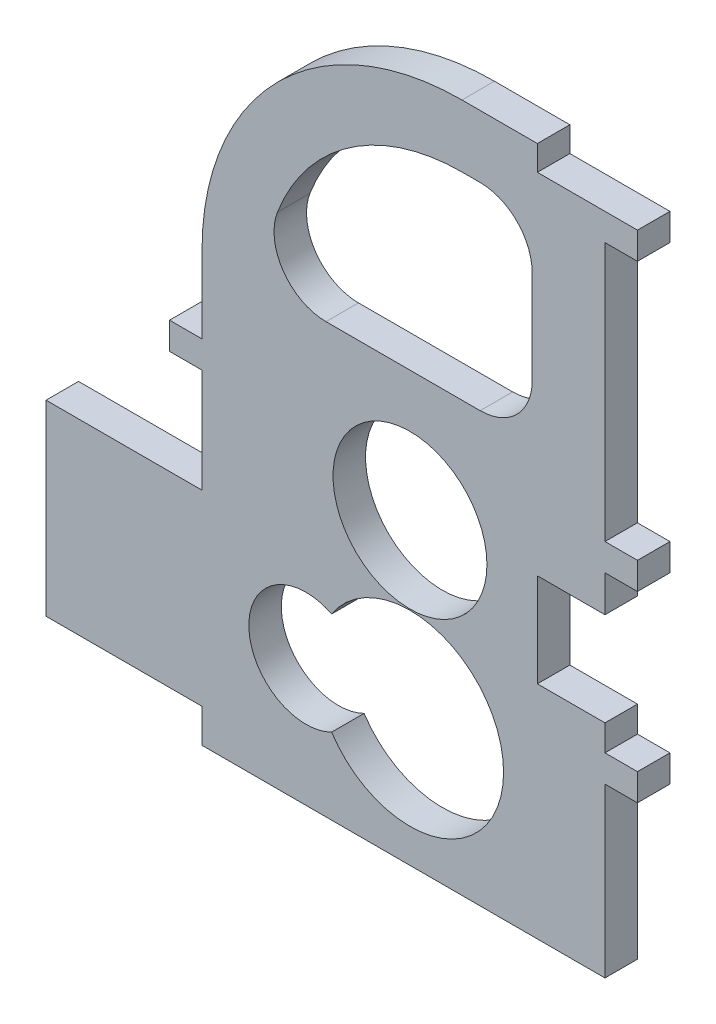
from build123d import *

# Parameters (mm, degrees)
SKETCH1_R           = 3.7592
BOSS_EXTRUDE1_DEPTH = 1.5875
CUT_EXTRUDE1_REACH  = 28.107
SKETCH2_W           = 3.302
SKETCH2_H           = 4.572
SKETCH2_H_2         = 1.2192
FILLET1_R           = 2.54


with BuildPart() as part:
    # Sketch1 → Boss-Extrude1 (new body)
    with BuildSketch(Plane.XY):
        with BuildLine():
            Line((11.112499999, 17.8308), (9.524999999, 17.8308))
            Line((9.524999999, 17.8308), (9.524999999, 19.05))
            Line((9.524999999, 19.05), (2.54, 19.05))
            ThreePointArc((2.54, 19.05), (-6.440256121, 15.330256121), (-10.16, 6.35))
            Line((-10.16, 6.35), (-10.16, 2.5908))
            Line((-10.160000001, 2.5908), (-11.747500001, 2.5908))
            Line((-11.747500001, 2.5908), (-11.747500001, 1.27))
            Line((-11.747500001, 1.27), (-10.160000001, 1.27))
            Line((-10.160000001, 1.27), (-10.160000001, -3.81))
            Line((-10.160000001, -3.81), (-17.78, -3.81))
            Line((-17.78, -3.81), (-17.78, -12.954))
            Line((-17.78, -12.954), (-10.16, -12.954))
            Line((-10.160000001, -12.954), (-10.160000001, -14.605))
            Line((-10.160000001, -14.605), (9.524999999, -14.605))
            Line((9.524999999, -14.605), (9.524999999, -6.4008))
            Line((9.524999999, -6.4008), (11.112499999, -6.4008))
            Line((11.112499999, -6.4008), (11.112499999, -5.08))
            Line((11.112499999, -5.08), (9.524999999, -5.08))
            Line((9.524999999, -5.08), (9.524999999, 2.54))
            Line((9.525, 2.54), (11.1125, 2.54))
            Line((11.1125, 2.54), (11.1125, 3.8608))
            Line((11.1125, 3.8608), (9.525, 3.8608))
            Line((9.524999999, 3.8608), (9.524999999, 16.51))
            Line((9.524999999, 16.51), (11.112499999, 16.51))
            Line((11.112499999, 16.51), (11.112499999, 17.8308))
        make_face()
        with BuildLine():
            ThreePointArc((-7.112, 6.35), (-4.284994652, 13.174994652), (2.54, 16.002))
            Line((2.54, 16.002), (5.968999999, 16.002))
            Line((5.968999999, 16.002), (5.968999999, 6.35))
            Line((5.968999999, 6.35), (-7.112, 6.35))
        make_face(mode=Mode.SUBTRACT)
        with BuildLine():
            ThreePointArc((-3.82905, -5.883688551), (4.572, -8.382), (-3.82905, -10.880311449))
            ThreePointArc((-3.82905, -10.880311449), (-7.874, -8.382), (-3.82905, -5.883688551))
        make_face(mode=Mode.SUBTRACT)
        Circle(SKETCH1_R, mode=Mode.SUBTRACT)
    extrude(amount=BOSS_EXTRUDE1_DEPTH)

    # Sketch2 → Cut-Extrude1 (cut, up to next)
    with BuildSketch(Plane.XY.offset(1.5875), mode=Mode.PRIVATE) as cut_extrude1_sk1:
        with Locations((7.873999999, -1.524)):
            Rectangle(SKETCH2_W, SKETCH2_H)
    cut_extrude1_tool1 = extrude(cut_extrude1_sk1.sketch, amount=-CUT_EXTRUDE1_REACH, mode=Mode.PRIVATE) & part.part
    # Sketch2 → Cut-Extrude1 (cut, up to next)
    with BuildSketch(Plane.XY.offset(1.5875), mode=Mode.PRIVATE) as cut_extrude1_sk2:
        with Locations((7.873999999, 18.4404)):
            Rectangle(SKETCH2_W, SKETCH2_H_2)
    cut_extrude1_tool2 = extrude(cut_extrude1_sk2.sketch, amount=-CUT_EXTRUDE1_REACH, mode=Mode.PRIVATE) & part.part
    add(cut_extrude1_tool1.solids().sort_by_distance((7.874, -1.524, 1.5875))[0], mode=Mode.SUBTRACT)
    add(cut_extrude1_tool2.solids().sort_by_distance((7.874, 18.4404, 1.5875))[0], mode=Mode.SUBTRACT)

    # Fillet1
    fillet1_edges = [part.edges().sort_by_distance(p)[0] for p in [
        (-7.112, 6.35, 0.79375),
        (5.968999999, 16.002, 0.79375),
        (5.968999999, 6.35, 0.79375),
    ]]
    fillet(fillet1_edges, radius=FILLET1_R)


solid = part.part
